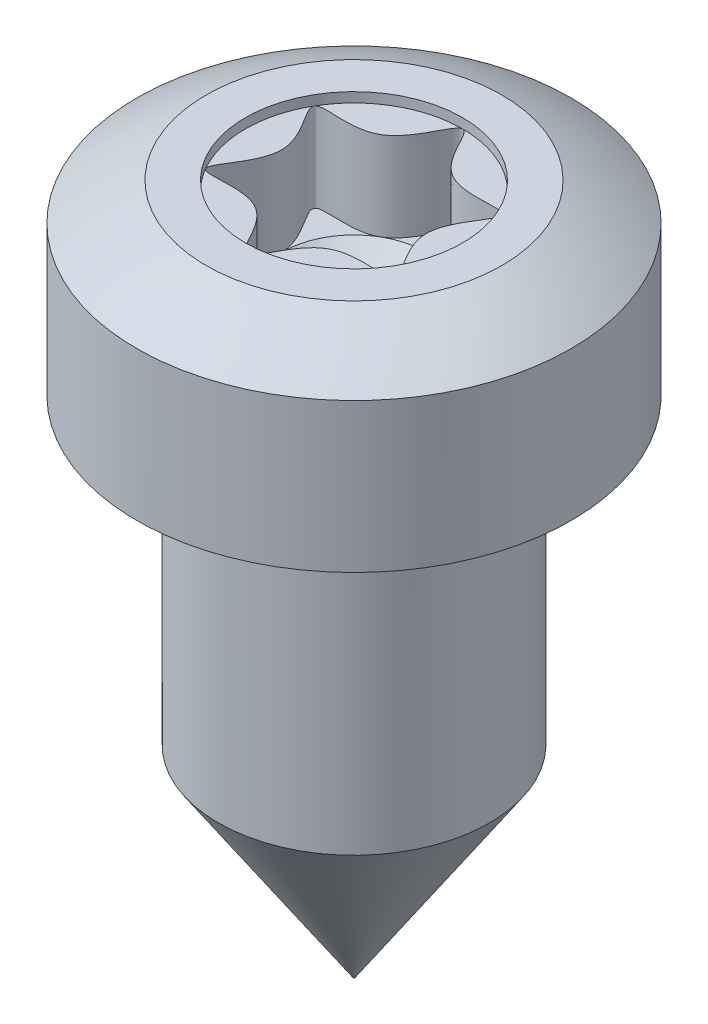
from build123d import *

# Parameters (mm, degrees)
RECESS_CUT_EXTRUDE1_DEPTH = 1.27
SKETCH5_R                 = 1.4
RECESS_CUT_EXTRUDE2_DEPTH = 0.127
FILLET1_R                 = 0.1


with BuildPart() as part:
    # Sketch1 → Body-Revolve (revolve)
    with BuildSketch(Plane.XY):
        Polygon((0, 0), (0, 8.9), (2.8, 8.9), (2.8, 6.5), (1.75, 6.5), (1.75, 0), align=None)
    revolve(axis=Axis((0, 0, 0), (0, 1, 0)))

    # Sketch3 → Head-Cut-Revolve (revolve, cut)
    with BuildSketch(Plane.XY):
        with BuildLine():
            Line((0, 9.277536965), (0, 10.404372915))
            Line((0, 10.404372915), (5, 10.404372915))
            Line((5, 10.404372915), (5, 4.277536965))
            ThreePointArc((5, 4.277536965), (3.535533906, 7.81307087), (0, 9.277536965))
        make_face()
    revolve(axis=Axis((0, 0, 0), (0, 1, 0)), mode=Mode.SUBTRACT)

    # Sketch4 → Recess-Cut-Extrude1 (cut)
    with BuildSketch(Plane(origin=(0, 8.9, 0), x_dir=(-1, 0, 0), z_dir=(0, 1, 0))):
        with BuildLine():
            add(Edge.make_bspline(
                [(0, -1.4), (-0.100650939, -1.4), (-0.301952816, -0.522997619), (-1.592188736, -0.919250595), (-0.603905632, 0), (-1.592188736, 0.919250595), (-0.301952816, 0.522997619), (0, 1.838501191), (0.301952816, 0.522997619), (1.592188736, 0.919250595), (0.603905632, 0), (1.592188736, -0.919250595), (0.301952816, -0.522997619), (0.100650939, -1.4), (0, -1.4)],
                knots=[0, 0, 0, 0, 0.083333333, 0.166666667, 0.25, 0.333333333, 0.416666667, 0.5, 0.583333333, 0.666666667, 0.75, 0.833333333, 0.916666667, 1, 1, 1, 1], degree=3))
        make_face()
    extrude(amount=-RECESS_CUT_EXTRUDE1_DEPTH, mode=Mode.SUBTRACT)

    # Sketch5 → Recess-Cut-Extrude2 (cut)
    with BuildSketch(Plane(origin=(0, 8.9, 0), x_dir=(-1, 0, 0), z_dir=(0, 1, 0))):
        Circle(SKETCH5_R)
    extrude(amount=-RECESS_CUT_EXTRUDE2_DEPTH, mode=Mode.SUBTRACT)

    # Sketch6 → Drill-Cut-Revolve (revolve, cut)
    with BuildSketch(Plane.XY):
        Polygon((0, 7.63), (0.933333333, 7.63), (0, 6.74), align=None)
    revolve(axis=Axis((0, 0, 0), (0, 1, 0)), mode=Mode.SUBTRACT)

    # Fillet1
    fillet1_edges = [part.edges().sort_by_distance(p)[0] for p in [
        (-1.75, 6.5, 0),
    ]]
    fillet(fillet1_edges, radius=FILLET1_R)

    # Sketch7 → Body-Cut-Revolve (revolve, cut)
    with BuildSketch(Plane.XY):
        Polygon((1.75, 0), (1.75, 2.6), (0.01, 0), align=None)
    revolve(axis=Axis((0, 0, 0), (0, 1, 0)), mode=Mode.SUBTRACT)


solid = part.part
